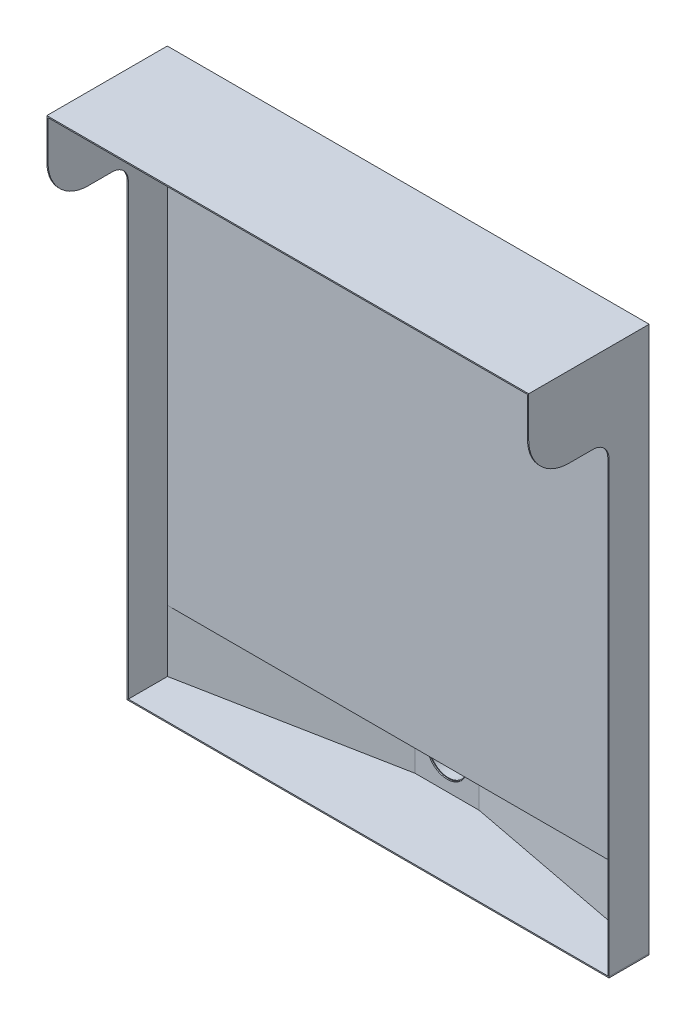
from build123d import *

# Parameters (mm, degrees)
SKETCH_6_W                 = 600
SKETCH_6_H                 = 680
EXTRUDE_2_DEPTH            = 150
EXTRUDE_4_DEPTH            = 80
SHELL_START                = -338.5
SHELL_2_OUTLINE_W          = 597
SHELL_2_OUTLINE_H          = 148.5
SHELL_2_DEPTH              = 677
SHELL_2_2_DEPTH            = 77
SKETCH_13_R                = 25
CUT_EXTRUDE_1_DEPTH        = 496.580467735
SPLIT_START                = -340
SPLIT_BODIES_5_DEPTH       = 1.5
SPLIT_BODIES_5_2_OUTLINE_W = 602
SPLIT_BODIES_5_2_OUTLINE_H = 203
SPLIT_BODIES_5_2_DEPTH     = 1.5
SKETCH_15_W                = 200.791070075
SKETCH_15_H                = 666.3886285
CUT_EXTRUDE_2_DEPTH        = 706.761999544
FILLET_1_R                 = 20
FILLET_2_R                 = 50
SKETCH_16_R                = 25
SKETCH_16_R_2              = 24
EXTRUDE_5_DEPTH            = 25


# Read off the part's stored shape, not the designer's step: 抽壳2, 分割5
with BuildPart() as part:
    # 草图6 → 凸台-拉伸2 (new body)
    with BuildSketch(Plane.XY):
        Rectangle(SKETCH_6_W, SKETCH_6_H)
    extrude(amount=EXTRUDE_2_DEPTH)

    # 草图8 → 凸台-拉伸4 (add)
    with BuildSketch(Plane.XZ.offset(340)):
        Polygon((-300, 0), (-40, -50), (40, -50), (300, 0), align=None)
    extrude(amount=-EXTRUDE_4_DEPTH)

    # 抽壳2 outline → 抽壳2 (cut)
    with BuildSketch(Plane(origin=(0, 0, 0), x_dir=(1, 0, 0), z_dir=(0, 1, 0)).offset(SHELL_START)):
        with Locations((0, -75.75)):
            Rectangle(SHELL_2_OUTLINE_W, SHELL_2_OUTLINE_H)
    extrude(amount=SHELL_2_DEPTH, mode=Mode.SUBTRACT)

    # Shell 2 2 outline → Shell 2 2 (cut)
    with BuildSketch(Plane(origin=(0, 0, 0), x_dir=(1, 0, 0), z_dir=(0, 1, 0)).offset(SHELL_START)):
        Polygon((-298.5, -1.5), (298.5, -1.5), (298.5, -1.239023342), (39.857078623, 48.5), (-39.857078623, 48.5), (-298.5, -1.239023342), align=None)
    extrude(amount=SHELL_2_2_DEPTH, mode=Mode.SUBTRACT)

    # 草图13 → 切除-拉伸1 (cut, through all)
    with BuildSketch(Plane(origin=(0, 0, -50), x_dir=(-1, 0, 0), z_dir=(0, 0, -1))):
        with Locations((0, -300)):
            Circle(SKETCH_13_R)
    extrude(amount=-CUT_EXTRUDE_1_DEPTH, mode=Mode.SUBTRACT)

    # Split Bodies 5 2 outline → Split Bodies 5 2 (cut)
    with BuildSketch(Plane(origin=(0, 0, 0), x_dir=(1, 0, 0), z_dir=(0, 1, 0)).offset(SPLIT_START)):
        with Locations((0, -49.5)):
            Rectangle(SPLIT_BODIES_5_2_OUTLINE_W, SPLIT_BODIES_5_2_OUTLINE_H)
    extrude(amount=SPLIT_BODIES_5_2_DEPTH, mode=Mode.SUBTRACT)


with BuildPart() as body_2:
    # Split Bodies 5 outline → Split Bodies 5 (new body)
    with BuildSketch(Plane(origin=(0, 0, 0), x_dir=(1, 0, 0), z_dir=(0, 1, 0)).offset(SPLIT_START)):
        Polygon((-300, -150), (300, -150), (300, 0), (40, 50), (-40, 50), (-300, 0), align=None)
    extrude(amount=SPLIT_BODIES_5_DEPTH)


with BuildPart() as cut_extrude_2_tool:
    # 草图15 → 切除-拉伸2 (new, through all)
    with BuildSketch(Plane.ZY.offset(300)):
        with Locations((150.395535037, -93.19431425)):
            Rectangle(SKETCH_15_W, SKETCH_15_H)
    extrude(amount=-CUT_EXTRUDE_2_DEPTH)


with BuildPart() as part_1:
    add(part.part)

    # 切除-拉伸2: cut by cut_extrude_2_tool
    add(cut_extrude_2_tool.part, mode=Mode.SUBTRACT)

    # 圆角1
    fillet_1_edges = [part_1.edges().sort_by_distance(p)[0] for p in [
        (-299.25, 240, 50),
        (299.25, 240, 50),
    ]]
    fillet(fillet_1_edges, radius=FILLET_1_R)

    # 圆角2
    fillet_2_edges = [part_1.edges().sort_by_distance(p)[0] for p in [
        (-299.25, 240, 150),
        (299.25, 240, 150),
    ]]
    fillet(fillet_2_edges, radius=FILLET_2_R)


with BuildPart() as body_2_1:
    add(body_2.part)

    # 切除-拉伸2: cut by cut_extrude_2_tool
    add(cut_extrude_2_tool.part, mode=Mode.SUBTRACT)


with BuildPart() as body_3:
    # 草图16 → 凸台-拉伸5 (new body)
    with BuildSketch(Plane(origin=(0, 0, -50), x_dir=(-1, 0, 0), z_dir=(0, 0, -1))):
        with Locations((0, -300)):
            Circle(SKETCH_16_R)
        with Locations((0, -300)):
            Circle(SKETCH_16_R_2, mode=Mode.SUBTRACT)
    extrude(amount=EXTRUDE_5_DEPTH)


solid = Compound([part_1.part, body_2_1.part, body_3.part])
